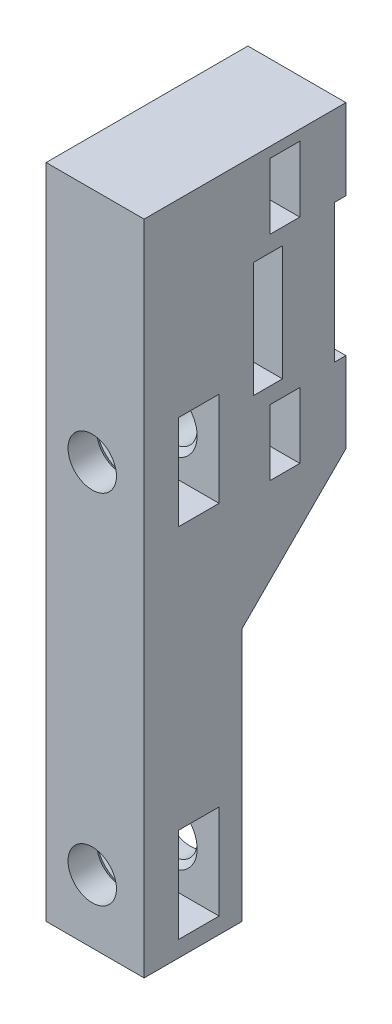
from build123d import *

# Parameters (mm, degrees)
ESQUISSE1_W              = 8.5
ESQUISSE1_H              = 72
ESQUISSE1_R              = 2.1
BOSS_EXTRU_1_DEPTH       = 17.5
ENL_V_START              = -3
ENL_V_MAT_EXTRU_4_DEPTH  = 3.5
ESQUISSE7_R              = 2.1
BOSS_EXTRU_3_DEPTH       = 7
ESQUISSE3_W              = 8.5
ESQUISSE3_H              = 4
ENL_V_MAT_EXTRU_3_DEPTH  = 19
BOSS_EXTRU_2_START       = -7
BOSS_EXTRU_2_DEPTH       = 12
ESQUISSE8_W              = 8.5
ESQUISSE8_H              = 7
BOSS_EXTRU_4_DEPTH       = 4
ESQUISSE9_R              = 1.6
ENL_V_MAT_EXTRU_5_DEPTH  = 5
ENL_V_START_2            = -4
ESQUISSE10_R             = 1.6
ENL_V_MAT_EXTRU_6_DEPTH  = 2.6
ESQUISSE11_R             = 1.6
ENL_V_MAT_EXTRU_7_DEPTH  = 1.6
ESQUISSE14_W             = 2.5
ESQUISSE14_H             = 10
ENL_V_MAT_EXTRU_9_DEPTH  = 17.6
CHANFREIN1_SIZE          = 0.5
ESQUISSE15_W             = 8.5
ESQUISSE15_H             = 15
ESQUISSE15_W_2           = 2.6
ESQUISSE15_H_2           = 5.7
ESQUISSE15_W_3           = 2.5
ESQUISSE15_H_3           = 10
ENL_V_MAT_EXTRU_10_DEPTH = 10
CHANFREIN2_SIZE          = 9


with BuildPart() as part:
    # Esquisse1 → Boss.-Extru.1 (new body)
    with BuildSketch(Plane.XY):
        with Locations((4.25, 36)):
            Rectangle(ESQUISSE1_W, ESQUISSE1_H)
        with Locations((4, 20.5)):
            Circle(ESQUISSE1_R, mode=Mode.SUBTRACT)
        with Locations((4, 51.5)):
            Circle(ESQUISSE1_R, mode=Mode.SUBTRACT)
    extrude(amount=BOSS_EXTRU_1_DEPTH)

    # Esquisse6 → Enlèv. mat.-Extru.4 (cut)
    with BuildSketch(Plane.XY.offset(17.5).offset(ENL_V_START)):
        Polygon((7.55, 22.549593456), (4, 24.599186911), (0.45, 22.549593456), (0.45, 18.450406544), (4, 16.400813089), (7.55, 18.450406544), align=None)
        Polygon((8.5, 24.599186911), (4, 24.599186911), (7.55, 22.549593456), (7.55, 18.450406544), (4, 16.400813089), (8.5, 16.400813089), align=None)
    enl_v_mat_extru_4 = extrude(amount=-ENL_V_MAT_EXTRU_4_DEPTH, mode=Mode.SUBTRACT)

    # Esquisse7 → Boss.-Extru.3 (add)
    with BuildSketch(Plane(origin=(0, 0, 0), x_dir=(-1, 0, 0), z_dir=(0, 0, -1))):
        with Locations((-4, 20.5)):
            Circle(ESQUISSE7_R)
    boss_extru_3 = extrude(amount=-BOSS_EXTRU_3_DEPTH)

    # Esquisse3 → Enlèv. mat.-Extru.3 (cut)
    with BuildSketch(Plane(origin=(0, 0, 0), x_dir=(-1, 0, 0), z_dir=(0, -1, 0))):
        with Locations((-4.25, -2)):
            Rectangle(ESQUISSE3_W, ESQUISSE3_H)
    enl_v_mat_extru_3 = extrude(amount=-ENL_V_MAT_EXTRU_3_DEPTH, mode=Mode.SUBTRACT)

    # Esquisse5 → Boss.-Extru.2 (add)
    with BuildSketch(Plane.XZ.offset(BOSS_EXTRU_2_START)):
        with BuildLine():
            ThreePointArc((4.662966644, 1.130359715), (4.682946936, 1.236721088), (4.714353535, 1.340285461))
            ThreePointArc((4.714353535, 1.340285461), (5.229781903, 1.749631615), (5.773646598, 1.378900082))
            ThreePointArc((5.773646598, 1.378900082), (5.814751932, 1.256791784), (5.839789089, 1.130406557))
            ThreePointArc((5.839789089, 1.130406557), (5.889607538, 1.037219203), (5.988503907, 1))
            Line((5.988503907, 1), (6.514258005, 1))
            ThreePointArc((6.514258005, 1), (6.613136611, 1.037203629), (6.662966644, 1.130359715))
            ThreePointArc((6.662966644, 1.130359715), (6.682946936, 1.236721088), (6.714353535, 1.340285461))
            ThreePointArc((6.714353535, 1.340285461), (7.229781903, 1.749631615), (7.773646598, 1.378900082))
            ThreePointArc((7.773646598, 1.378900082), (7.814751933, 1.256791779), (7.83978909, 1.130406547))
            ThreePointArc((7.83978909, 1.130406547), (7.889607542, 1.037219199), (7.988503907, 1))
            Line((7.988503907, 1), (8.5, 1))
            Line((8.5, 1), (8.5, 4))
            Line((8.5, 4), (0, 4))
            Line((0, 4), (0, 1))
            Line((0, 1), (0.514258005, 1))
            ThreePointArc((0.514258005, 1), (0.613136611, 1.037203629), (0.662966644, 1.130359715))
            ThreePointArc((0.662966644, 1.130359715), (0.682946936, 1.236721088), (0.714353535, 1.340285461))
            ThreePointArc((0.714353535, 1.340285461), (1.229781903, 1.749631615), (1.773646598, 1.378900082))
            ThreePointArc((1.773646598, 1.378900082), (1.814751933, 1.256791781), (1.83978909, 1.130406551))
            ThreePointArc((1.83978909, 1.130406551), (1.88960754, 1.037219201), (1.988503907, 1))
            Line((1.988503907, 1), (2.514258005, 1))
            ThreePointArc((2.514258005, 1), (2.613136611, 1.037203629), (2.662966644, 1.130359715))
            ThreePointArc((2.662966644, 1.130359715), (2.682946936, 1.236721088), (2.714353535, 1.340285461))
            ThreePointArc((2.714353535, 1.340285461), (3.229781903, 1.749631615), (3.773646598, 1.378900082))
            ThreePointArc((3.773646598, 1.378900082), (3.814751933, 1.256791781), (3.83978909, 1.130406551))
            ThreePointArc((3.83978909, 1.130406551), (3.88960754, 1.037219201), (3.988503907, 1))
            Line((3.988503907, 1), (4.514258005, 1))
            ThreePointArc((4.514258005, 1), (4.613136611, 1.037203629), (4.662966644, 1.130359715))
        make_face()
    boss_extru_2 = extrude(amount=-BOSS_EXTRU_2_DEPTH)

    # Esquisse8 → Boss.-Extru.4 (add)
    with BuildSketch(Plane(origin=(0, 0, 4), x_dir=(-1, 0, 0), z_dir=(0, 0, -1))):
        with Locations((-4.25, 3.5)):
            Rectangle(ESQUISSE8_W, ESQUISSE8_H)
    boss_extru_4 = extrude(amount=BOSS_EXTRU_4_DEPTH)

    # Esquisse9 → Enlèv. mat.-Extru.5 (cut)
    with BuildSketch(Plane(origin=(0, 0, 0), x_dir=(-1, 0, 0), z_dir=(0, 0, -1))):
        with Locations((-4.25, 3.75)):
            Circle(ESQUISSE9_R)
        with Locations((-4.25, 22.25)):
            Circle(ESQUISSE9_R)
    enl_v_mat_extru_5 = extrude(amount=-ENL_V_MAT_EXTRU_5_DEPTH, mode=Mode.SUBTRACT)

    # Esquisse10 → Enlèv. mat.-Extru.6 (cut)
    # profile 1 of 4: a face of its own
    with BuildSketch(Plane(origin=(0, 0, 0), x_dir=(-1, 0, 0), z_dir=(0, 0, -1)).offset(ENL_V_START_2)):
        Polygon((-2.604551733, 25.1), (-5.895448267, 25.1), (-7.540896534, 22.25), (-5.895448267, 19.4), (-2.604551733, 19.4), (-0.959103466, 22.25), align=None)
        with Locations((-4.25, 22.25)):
            Circle(ESQUISSE10_R, mode=Mode.SUBTRACT)
    # profile 2 of 4: a face of its own
    with BuildSketch(Plane(origin=(0, 0, 0), x_dir=(-1, 0, 0), z_dir=(0, 0, -1)).offset(ENL_V_START_2)):
        Polygon((-2.604551733, 6.6), (-5.895448267, 6.6), (-7.540896534, 3.75), (-5.895448267, 0.9), (-2.604551733, 0.9), (-0.959103466, 3.75), align=None)
    # profile 3 of 4: a face of its own
    with BuildSketch(Plane(origin=(0, 0, 0), x_dir=(-1, 0, 0), z_dir=(0, 0, -1)).offset(ENL_V_START_2)):
        Polygon((-8.5, 6.6), (-5.895448267, 6.6), (-7.540896534, 3.75), (-5.895448267, 0.9), (-8.5, 0.9), align=None)
    # profile 4 of 4: a face of its own
    with BuildSketch(Plane(origin=(0, 0, 0), x_dir=(-1, 0, 0), z_dir=(0, 0, -1)).offset(ENL_V_START_2)):
        Polygon((-7.540896534, 22.25), (-5.895448267, 25.1), (-8.5, 25.1), (-8.5, 19.4), (-5.895448267, 19.4), align=None)
    enl_v_mat_extru_6 = extrude(amount=-ENL_V_MAT_EXTRU_6_DEPTH, mode=Mode.SUBTRACT)

    # Esquisse11 → Enlèv. mat.-Extru.7 (cut)
    with BuildSketch(Plane(origin=(0, 0, 5), x_dir=(-1, 0, 0), z_dir=(0, 0, -1))):
        with Locations((-4.25, 22.25)):
            Circle(ESQUISSE11_R)
    enl_v_mat_extru_7 = extrude(amount=-ENL_V_MAT_EXTRU_7_DEPTH, mode=Mode.SUBTRACT)

    # Esquisse14 → Enlèv. mat.-Extru.9 (cut)
    with BuildSketch(Plane(origin=(8.5, 0, 0), x_dir=(0, 0, -1), z_dir=(1, 0, 0))):
        with Locations((-6.75, 13)):
            Rectangle(ESQUISSE14_W, ESQUISSE14_H)
    enl_v_mat_extru_9 = extrude(amount=-ENL_V_MAT_EXTRU_9_DEPTH, mode=Mode.SUBTRACT)

    # Symétrie14: Enlèv. mat.-Extru.4, Boss.-Extru.3, Enlèv. mat.-Extru.3, Boss.-Extru.2, Boss.-Extru.4, Enlèv. mat.-Extru.5, Enlèv. mat.-Extru.6, Enlèv. mat.-Extru.7, Enlèv. mat.-Extru.9 across plane
    add(enl_v_mat_extru_4.mirror(Plane(origin=(0, 36, 0), x_dir=(0, 0, 1), z_dir=(0, -1, 0))), mode=Mode.SUBTRACT)
    add(boss_extru_3.mirror(Plane(origin=(0, 36, 0), x_dir=(0, 0, 1), z_dir=(0, -1, 0))))
    add(enl_v_mat_extru_3.mirror(Plane(origin=(0, 36, 0), x_dir=(0, 0, 1), z_dir=(0, -1, 0))), mode=Mode.SUBTRACT)
    add(boss_extru_2.mirror(Plane(origin=(0, 36, 0), x_dir=(0, 0, 1), z_dir=(0, -1, 0))))
    add(boss_extru_4.mirror(Plane(origin=(0, 36, 0), x_dir=(0, 0, 1), z_dir=(0, -1, 0))))
    add(enl_v_mat_extru_5.mirror(Plane(origin=(0, 36, 0), x_dir=(0, 0, 1), z_dir=(0, -1, 0))), mode=Mode.SUBTRACT)
    add(enl_v_mat_extru_6.mirror(Plane(origin=(0, 36, 0), x_dir=(0, 0, 1), z_dir=(0, -1, 0))), mode=Mode.SUBTRACT)
    add(enl_v_mat_extru_7.mirror(Plane(origin=(0, 36, 0), x_dir=(0, 0, 1), z_dir=(0, -1, 0))), mode=Mode.SUBTRACT)
    add(enl_v_mat_extru_9.mirror(Plane(origin=(0, 36, 0), x_dir=(0, 0, 1), z_dir=(0, -1, 0))), mode=Mode.SUBTRACT)

    # Chanfrein1
    chanfrein1_edges = [part.edges().sort_by_distance(p)[0] for p in [
        (1.9, 51.5, 14.5),
        (1.9, 51.5, 11),
        (1.9, 20.5, 11),
        (1.9, 20.5, 14.5),
    ]]
    chamfer(chanfrein1_edges, length=CHANFREIN1_SIZE)

    # Esquisse15 → Enlèv. mat.-Extru.10 (cut)
    # profile 1 of 2: a face of its own
    with BuildSketch(Plane(origin=(8.5, 0, 0), x_dir=(0, 0, -1), z_dir=(1, 0, 0))):
        with Locations((-13.25, 7.5)):
            Rectangle(ESQUISSE15_W, ESQUISSE15_H)
    # profile 2 of 2: a face of its own
    with BuildSketch(Plane(origin=(8.5, 0, 0), x_dir=(0, 0, -1), z_dir=(1, 0, 0))):
        Polygon((-9, 0), (0, 0), (0, 7), (-1, 7), (-1, 19), (0, 19), (0, 46), (-9, 46), (-9, 15), align=None)
        with Locations((-5.3, 3.75)):
            Rectangle(ESQUISSE15_W_2, ESQUISSE15_H_2, mode=Mode.SUBTRACT)
        with Locations((-6.75, 13)):
            Rectangle(ESQUISSE15_W_3, ESQUISSE15_H_3, mode=Mode.SUBTRACT)
        with Locations((-5.3, 22.25)):
            Rectangle(ESQUISSE15_W_2, ESQUISSE15_H_2, mode=Mode.SUBTRACT)
    extrude(amount=-ENL_V_MAT_EXTRU_10_DEPTH, mode=Mode.SUBTRACT)


with BuildPart() as enl_v_mat_extru_10_kept_piece:
    # of the separate pieces the step leaves, the one the design keeps (enl_v_mat_extru_10_pieces_kept)
    add(part.part.solids().sort_by_distance((6.6, 20.5, 14.5))[0])

    # Chanfrein2
    chanfrein2_edges = [enl_v_mat_extru_10_kept_piece.edges().sort_by_distance(p)[0] for p in [
        (4.25, 46, 9),
    ]]
    chamfer(chanfrein2_edges, length=CHANFREIN2_SIZE - 0.0001)  # a hair under: the kernel refuses the full size


solid = enl_v_mat_extru_10_kept_piece.part
